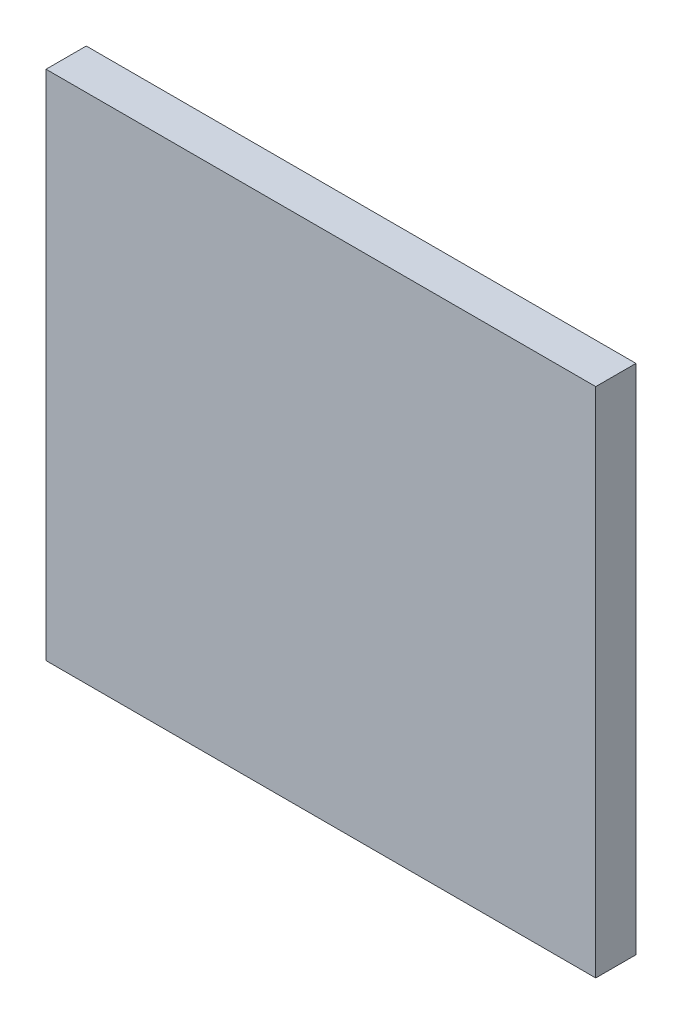
from build123d import *

# Parameters (mm, degrees)
TABAN_FLAN_1_DEPTH          = 30
KES_EKSTR_ZYON1_DEPTH       = 6325.626471184
KES_EKSTR_ZYON1_DEPTH_BACK  = 6325.626471184
IZIM2_W                     = 3213
IZIM2_H                     = 310
IZIM3_W                     = 24
IZIM3_H                     = 2000
SEKME1_DEPTH                = 30
KES_EKSTR_ZYON2_DEPTH       = 6348.399152409
KES_EKSTR_ZYON2_DEPTH_BACK  = 6348.399152409
IZIM4_W                     = 3210
IZIM4_H                     = 305
KES_EKSTR_ZYON3_DEPTH       = 6348.399152409
KES_EKSTR_ZYON3_DEPTH_BACK  = 6348.399152409
IZIM5_W                     = 3210
IZIM5_H                     = 405
KES_EKSTR_ZYON4_DEPTH       = 6348.399152409
KES_EKSTR_ZYON4_DEPTH_BACK  = 6348.399152409
IZIM6_W                     = 2910
IZIM6_H                     = 310
IZIM6_W_2                   = 300
IZIM7_W                     = 2811
IZIM7_H                     = 5
SEKME2_DEPTH                = 30
CUT_EXTRUDE1_DEPTH          = 6349.976374188
CUT_EXTRUDE1_DEPTH_BACK     = 6349.976374188
SKETCH1_W                   = 2835
SKETCH1_H                   = 1158
KES_EKSTR_ZYON5_DEPTH       = 6084.328447487
KES_EKSTR_ZYON5_DEPTH_BACK  = 6084.328447487
IZIM9_W                     = 2635
IZIM9_H                     = 310
IZIM10_W                    = 575
IZIM10_H                    = 2
SEKME3_DEPTH                = 30
KES_EKSTR_ZYON6_DEPTH       = 6084.328447487
KES_EKSTR_ZYON6_DEPTH_BACK  = 6084.328447487
IZIM13_W                    = 575
IZIM13_H                    = 2
KES_EKSTR_ZYON7_DEPTH       = 6084.328447487
KES_EKSTR_ZYON7_DEPTH_BACK  = 6084.328447487
KES_EKSTR_ZYON8_DEPTH       = 5441.42139912
KES_EKSTR_ZYON8_DEPTH_BACK  = 5441.42139912
IZIM16_W                    = 4
IZIM16_H                    = 537
KES_EKSTR_ZYON9_DEPTH       = 5437.470270313
KES_EKSTR_ZYON9_DEPTH_BACK  = 5437.470270313
IZIM17_W                    = 1750
IZIM17_H                    = 537
KES_EKSTR_ZYON10_DEPTH      = 3718.890396448
KES_EKSTR_ZYON10_DEPTH_BACK = 3718.890396448
IZIM18_W                    = 410
IZIM18_H                    = 155


# Sheet-metal steps are written as plain solids
with BuildPart() as part:
    # Çizim1 → Taban-Flanş1 (new body)
    with BuildSketch(Plane.XY):
        Polygon((0, 0), (0, -1640), (3210, -1640), (3210, -2000), (6000, -2000), (6000, 0), align=None)
    extrude(amount=-TABAN_FLAN_1_DEPTH)

    # Çizim2 → Kes-Ekstrüzyon1 (cut, two sides: drawn at the far end of the back side and taken through both)
    with BuildSketch(Plane.XY.offset(-KES_EKSTR_ZYON1_DEPTH_BACK)):
        with Locations((1606.5, -1485)):
            Rectangle(IZIM2_W, IZIM2_H)
    extrude(amount=KES_EKSTR_ZYON1_DEPTH + KES_EKSTR_ZYON1_DEPTH_BACK, mode=Mode.SUBTRACT)

    # Çizim3 → Sekme1 (add)
    with BuildSketch(Plane.XY):
        with Locations((6012, -1000)):
            Rectangle(IZIM3_W, IZIM3_H)
    extrude(amount=-SEKME1_DEPTH)

    # Çizim4 → Kes-Ekstrüzyon2 (cut, two sides: drawn at the far end of the back side and taken through both)
    with BuildSketch(Plane.XY.offset(-KES_EKSTR_ZYON2_DEPTH_BACK)):
        with Locations((1605, -1177.5)):
            Rectangle(IZIM4_W, IZIM4_H)
    extrude(amount=KES_EKSTR_ZYON2_DEPTH + KES_EKSTR_ZYON2_DEPTH_BACK, mode=Mode.SUBTRACT)

    # Çizim5 → Kes-Ekstrüzyon3 (cut, two sides: drawn at the far end of the back side and taken through both)
    with BuildSketch(Plane.XY.offset(-KES_EKSTR_ZYON3_DEPTH_BACK)):
        with Locations((1605, -822.5)):
            Rectangle(IZIM5_W, IZIM5_H)
    extrude(amount=KES_EKSTR_ZYON3_DEPTH + KES_EKSTR_ZYON3_DEPTH_BACK, mode=Mode.SUBTRACT)

    # Çizim6 → Kes-Ekstrüzyon4 (cut, two sides: drawn at the far end of the back side and taken through both)
    with BuildSketch(Plane.XY.offset(-KES_EKSTR_ZYON4_DEPTH_BACK)):
        with Locations((1455, -465)):
            Rectangle(IZIM6_W, IZIM6_H)
        with Locations((3060, -465)):
            Rectangle(IZIM6_W_2, IZIM6_H)
    extrude(amount=KES_EKSTR_ZYON4_DEPTH + KES_EKSTR_ZYON4_DEPTH_BACK, mode=Mode.SUBTRACT)

    # Çizim7 → Sekme2 (add)
    with BuildSketch(Plane.XY):
        with Locations((4618.5, -2002.5)):
            Rectangle(IZIM7_W, IZIM7_H)
    extrude(amount=-SEKME2_DEPTH)

    # Sketch1 → Cut-Extrude1 (cut, two sides: drawn at the far end of the back side and taken through both)
    with BuildSketch(Plane.XY.offset(-CUT_EXTRUDE1_DEPTH_BACK)):
        with Locations((4627.5, -1426)):
            Rectangle(SKETCH1_W, SKETCH1_H)
    extrude(amount=CUT_EXTRUDE1_DEPTH + CUT_EXTRUDE1_DEPTH_BACK, mode=Mode.SUBTRACT)

    # Çizim9 → Kes-Ekstrüzyon5 (cut, two sides: drawn at the far end of the back side and taken through both)
    with BuildSketch(Plane.XY.offset(-KES_EKSTR_ZYON5_DEPTH_BACK)):
        with Locations((1317.5, -155)):
            Rectangle(IZIM9_W, IZIM9_H)
    extrude(amount=KES_EKSTR_ZYON5_DEPTH + KES_EKSTR_ZYON5_DEPTH_BACK, mode=Mode.SUBTRACT)

    # Çizim10 → Sekme3 (add)
    with BuildSketch(Plane.XY):
        with Locations((2922.5, -311)):
            Rectangle(IZIM10_W, IZIM10_H)
    extrude(amount=-SEKME3_DEPTH)

    # Çizim13 → Kes-Ekstrüzyon6 (cut, two sides: drawn at the far end of the back side and taken through both)
    with BuildSketch(Plane.XY.offset(-KES_EKSTR_ZYON6_DEPTH_BACK)):
        Polygon((5145, 0), (2635, 0), (2635, -310), (3210, -310), (5145, -310), align=None)
        with Locations((2922.5, -311)):
            Rectangle(IZIM13_W, IZIM13_H)
    extrude(amount=KES_EKSTR_ZYON6_DEPTH + KES_EKSTR_ZYON6_DEPTH_BACK, mode=Mode.SUBTRACT)

    # Çizim15 → Kes-Ekstrüzyon7 (cut, two sides: drawn at the far end of the back side and taken through both)
    with BuildSketch(Plane.XY.offset(-KES_EKSTR_ZYON7_DEPTH_BACK)):
        Polygon((5145, 0), (5145, -310), (5374, -310), (5374, -847), (6024, -847), (6024, 0), align=None)
    extrude(amount=KES_EKSTR_ZYON7_DEPTH + KES_EKSTR_ZYON7_DEPTH_BACK, mode=Mode.SUBTRACT)

    # Çizim16 → Kes-Ekstrüzyon8 (cut, two sides: drawn at the far end of the back side and taken through both)
    with BuildSketch(Plane.XY.offset(-KES_EKSTR_ZYON8_DEPTH_BACK)):
        with Locations((5372, -578.5)):
            Rectangle(IZIM16_W, IZIM16_H)
    extrude(amount=KES_EKSTR_ZYON8_DEPTH + KES_EKSTR_ZYON8_DEPTH_BACK, mode=Mode.SUBTRACT)

    # Çizim17 → Kes-Ekstrüzyon9 (cut, two sides: drawn at the far end of the back side and taken through both)
    with BuildSketch(Plane.XY.offset(-KES_EKSTR_ZYON9_DEPTH_BACK)):
        with Locations((4495, -578.5)):
            Rectangle(IZIM17_W, IZIM17_H)
    extrude(amount=KES_EKSTR_ZYON9_DEPTH + KES_EKSTR_ZYON9_DEPTH_BACK, mode=Mode.SUBTRACT)

    # Çizim18 → Kes-Ekstrüzyon10 (cut, two sides: drawn at the far end of the back side and taken through both)
    with BuildSketch(Plane.XY.offset(-KES_EKSTR_ZYON10_DEPTH_BACK)):
        with Locations((3415, -387.5)):
            Rectangle(IZIM18_W, IZIM18_H)
    extrude(amount=KES_EKSTR_ZYON10_DEPTH + KES_EKSTR_ZYON10_DEPTH_BACK, mode=Mode.SUBTRACT)


solid = part.part
